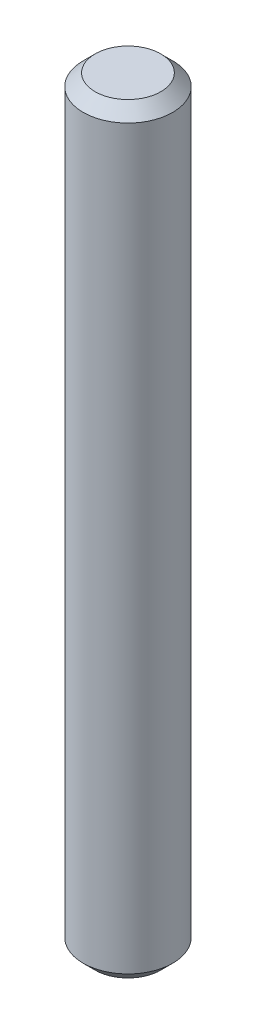
from build123d import *

# Parameters (mm, degrees)
SKETCH1_R           = 1.5
BOSS_EXTRUDE1_DEPTH = 12.75
CHAMFER1_SIZE       = 0.4


with BuildPart() as part:
    # Sketch1 → Boss-Extrude1 (new, symmetric)
    with BuildSketch(Plane(origin=(0, 0, 0), x_dir=(1, 0, 0), z_dir=(0, 1, 0))):
        Circle(SKETCH1_R)
    extrude(amount=BOSS_EXTRUDE1_DEPTH, both=True)

    # Chamfer1
    chamfer1_edges = [part.edges().sort_by_distance(p)[0] for p in [
        (-1.5, -12.75, 0),
        (-1.5, 12.75, 0),
    ]]
    chamfer(chamfer1_edges, length=CHAMFER1_SIZE)


solid = part.part
